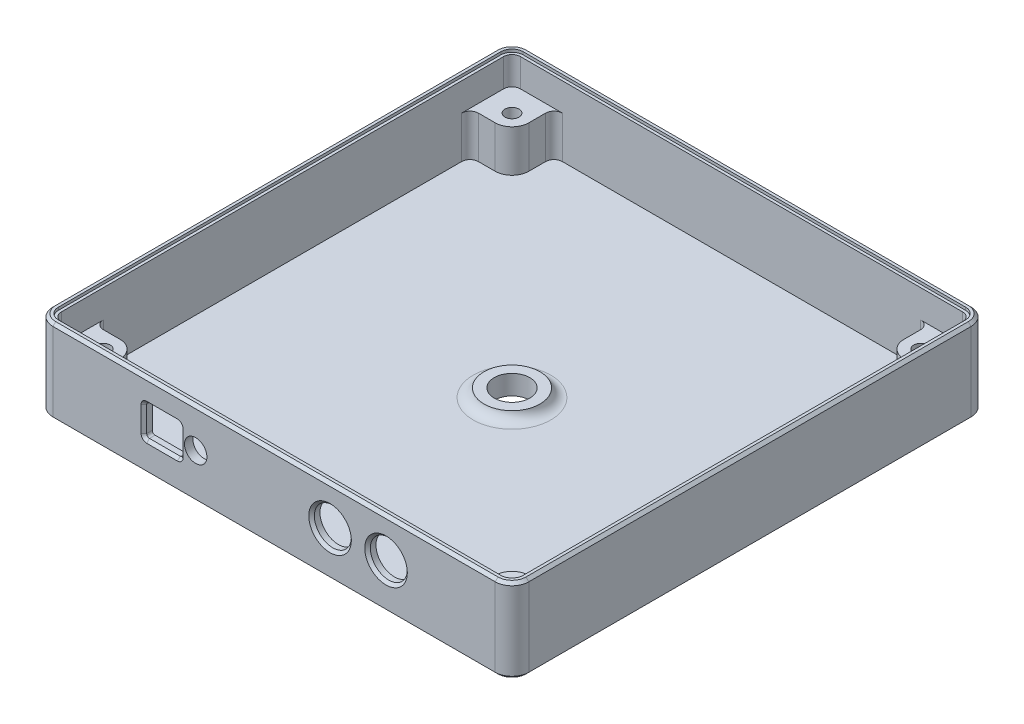
from build123d import *

# Parameters (mm, degrees)
SKETCH1_W                   = 85
SKETCH1_H                   = 85
BOSS_EXTRUDE1_DEPTH         = 15
FILLET1_R                   = 3
CHAMFER1_SIZE               = 0.5
CHAMFER2_SIZE               = 0.5
CUT_EXTRUDE1_DEPTH          = 11.5
F_1_4_0_25_DIAMETER_HOLE1_D = 6.35
BOSS_EXTRUDE2_START         = 6
BOSS_EXTRUDE2_DEPTH         = 6
FILLET2_R                   = 1.5
CUT_EXTRUDE2_START          = -1.5
SKETCH7_R                   = 5
CUT_EXTRUDE2_DEPTH          = 1.5
FILLET4_R                   = 2
SKETCH11_R                  = 2
SKETCH11_R_2                = 2.8
CUT_EXTRUDE4_DEPTH          = 10
CHAMFER4_SIZE               = 0.5
CUT_EXTRUDE5_DEPTH          = 0.5
SKETCH13_R                  = 1.25
CUT_EXTRUDE6_DEPTH          = 7


with BuildPart() as part:
    # Sketch1 → Boss-Extrude1 (new body)
    with BuildSketch(Plane(origin=(0, 0, 0), x_dir=(1, 0, 0), z_dir=(0, 1, 0))):
        with Locations((42.5, 42.5)):
            Rectangle(SKETCH1_W, SKETCH1_H)
    extrude(amount=BOSS_EXTRUDE1_DEPTH)

    # Fillet1
    fillet1_edges = [part.edges().sort_by_distance(p)[0] for p in [
        (0, 7.5, -85),
        (85, 7.5, -85),
        (85, 7.5, 0),
        (0, 7.5, 0),
    ]]
    fillet(fillet1_edges, radius=FILLET1_R)

    # Chamfer1
    chamfer1_edges = [part.edges().sort_by_distance(p)[0] for p in [
        (0, 0, -42.5),
        (42.5, 0, -85),
        (85, 0, -42.5),
        (42.5, 0, 0),
        (0.878679656, 0, -0.878679656),
        (84.121320344, 0, -0.878679656),
        (84.121320344, 0, -84.121320344),
        (0.878679656, 0, -84.121320344),
    ]]
    chamfer(chamfer1_edges, length=CHAMFER1_SIZE)

    # Chamfer2
    chamfer2_edges = [part.edges().sort_by_distance(p)[0] for p in [
        (0, 15, -42.5),
        (42.5, 15, -85),
        (42.5, 15, 0),
        (85, 15, -42.5),
        (0.878679656, 15, -0.878679656),
        (84.121320344, 15, -0.878679656),
        (84.121320344, 15, -84.121320344),
        (0.878679656, 15, -84.121320344),
    ]]
    chamfer(chamfer2_edges, length=CHAMFER2_SIZE)

    # Sketch2 → Cut-Extrude1 (cut)
    with BuildSketch(Plane(origin=(0, 15, 0), x_dir=(1, 0, 0), z_dir=(0, 1, 0))):
        with BuildLine():
            Line((83.5, 3), (83.5, 82))
            ThreePointArc((83.5, 82), (83.060660172, 83.060660172), (82, 83.5))
            Line((82, 83.5), (3, 83.5))
            ThreePointArc((3, 83.5), (1.939339828, 83.060660172), (1.5, 82))
            Line((1.5, 82), (1.5, 3))
            ThreePointArc((1.5, 3), (1.939339828, 1.939339828), (3, 1.5))
            Line((3, 1.5), (82, 1.5))
            ThreePointArc((82, 1.5), (83.060660172, 1.939339828), (83.5, 3))
        make_face()
    extrude(amount=-CUT_EXTRUDE1_DEPTH, mode=Mode.SUBTRACT)

    # 1/4 (0.25) Diameter Hole1 (through all)
    with Locations(Plane(origin=(42.5, 0, -42.5), x_dir=(0, 0, -1), z_dir=(0, -1, 0))):
        with Locations((0, 0)):
            Hole(F_1_4_0_25_DIAMETER_HOLE1_D / 2)

    # Sketch6 → Boss-Extrude2 (add)
    with BuildSketch(Plane(origin=(0, 3.5, 0), x_dir=(1, 0, 0), z_dir=(0, 1, 0)).offset(BOSS_EXTRUDE2_START)):
        with BuildLine():
            Line((1.5, 76), (6, 76))
            ThreePointArc((6, 76), (8.121320344, 76.878679656), (9, 79))
            Line((9, 79), (9, 83.5))
            Line((9, 83.5), (3, 83.5))
            ThreePointArc((3, 83.5), (1.939339828, 83.060660172), (1.5, 82))
            Line((1.5, 82), (1.5, 76))
        make_face()
        with BuildLine():
            Line((82, 83.5), (76, 83.5))
            Line((76, 83.5), (76, 79))
            ThreePointArc((76, 79), (76.878679656, 76.878679656), (79, 76))
            Line((79, 76), (83.5, 76))
            Line((83.5, 76), (83.5, 82))
            ThreePointArc((83.5, 82), (83.060660172, 83.060660172), (82, 83.5))
        make_face()
        with BuildLine():
            Line((6, 9), (1.5, 9))
            Line((1.5, 9), (1.5, 3))
            ThreePointArc((1.5, 3), (1.939339828, 1.939339828), (3, 1.5))
            Line((3, 1.5), (9, 1.5))
            Line((9, 1.5), (9, 6))
            ThreePointArc((9, 6), (8.121320344, 8.121320344), (6, 9))
        make_face()
        with BuildLine():
            Line((83.5, 3), (83.5, 9))
            Line((83.5, 9), (79, 9))
            ThreePointArc((79, 9), (76.878679656, 8.121320344), (76, 6))
            Line((76, 6), (76, 1.5))
            Line((76, 1.5), (82, 1.5))
            ThreePointArc((82, 1.5), (83.060660172, 1.939339828), (83.5, 3))
        make_face()
    extrude(amount=-BOSS_EXTRUDE2_DEPTH)

    # Fillet2
    fillet2_edges = [part.edges().sort_by_distance(p)[0] for p in [
        (9, 6.5, -1.5),
        (1.5, 6.5, -9),
        (1.5, 6.5, -76),
        (9, 6.5, -83.5),
        (83.5, 6.5, -9),
        (76, 6.5, -1.5),
        (83.5, 6.5, -76),
        (76, 6.5, -83.5),
    ]]
    fillet(fillet2_edges, radius=FILLET2_R)

    # Sketch7 → Cut-Extrude2 (cut)
    with BuildSketch(Plane(origin=(0, 3.5, 0), x_dir=(1, 0, 0), z_dir=(0, 1, 0)).offset(CUT_EXTRUDE2_START)):
        with BuildLine():
            Line((74.5, 83.5), (10.5, 83.5))
            ThreePointArc((10.5, 83.5), (9.439339828, 83.060660172), (9, 82))
            Line((9, 82), (9, 79))
            ThreePointArc((9, 79), (8.121320344, 76.878679656), (6, 76))
            Line((6, 76), (3, 76))
            ThreePointArc((3, 76), (1.939339828, 75.560660172), (1.5, 74.5))
            Line((1.5, 74.5), (1.5, 10.5))
            ThreePointArc((1.5, 10.5), (1.939339828, 9.439339828), (3, 9))
            Line((3, 9), (6, 9))
            ThreePointArc((6, 9), (8.121320344, 8.121320344), (9, 6))
            Line((9, 6), (9, 3))
            ThreePointArc((9, 3), (9.439339828, 1.939339828), (10.5, 1.5))
            Line((10.5, 1.5), (74.5, 1.5))
            ThreePointArc((74.5, 1.5), (75.560660172, 1.939339828), (76, 3))
            Line((76, 3), (76, 6))
            ThreePointArc((76, 6), (76.878679656, 8.121320344), (79, 9))
            Line((79, 9), (82, 9))
            ThreePointArc((82, 9), (83.060660172, 9.439339828), (83.5, 10.5))
            Line((83.5, 10.5), (83.5, 74.5))
            ThreePointArc((83.5, 74.5), (83.060660172, 75.560660172), (82, 76))
            Line((82, 76), (79, 76))
            ThreePointArc((79, 76), (76.878679656, 76.878679656), (76, 79))
            Line((76, 79), (76, 82))
            ThreePointArc((76, 82), (75.560660172, 83.060660172), (74.5, 83.5))
        make_face()
        with Locations(Location((42.5, 42.5, 0), (0, 0, 270))):
            Circle(SKETCH7_R, mode=Mode.SUBTRACT)
    extrude(amount=CUT_EXTRUDE2_DEPTH, mode=Mode.SUBTRACT)

    # Fillet4
    # the kernel refuses this fillet: 2 mm, written as the material it adds along each edge
    with BuildSketch(Plane(origin=(42.5, 2, -42.5), x_dir=(0, 0, 1), z_dir=(-1, 0, 0))) as fillet4_piece_1:
        with BuildLine():
            CenterArc((6.936491673, 2), FILLET4_R, 194.477512186, 75.522487814)
            Line((5, 1.5), (4.961270167, 1.49))
            ThreePointArc((4.961270167, 1.49), (4.96, 0.75), (4.96, 0))
            Line((4.96, 0), (5, -0.04))
            Line((5, -0.04), (6.936491673, -0.04))
            Line((6.936491673, -0.04), (6.936491673, 0))
        make_face()
    revolve(axis=Axis((42.5, 2, -42.5), (0, 1, 0)))

    # Sketch11 → Cut-Extrude4 (cut)
    # profile 1 of 7: a face of its own
    with BuildSketch(Plane.XY):
        with BuildLine():
            Line((25.249968416, 10.803831368), (19.749968416, 10.803830887))
            ThreePointArc((19.749968416, 10.803830887), (19.396415038, 10.657384247), (19.249968459, 10.303830844))
            Line((19.249968459, 10.303830844), (19.249968853, 5.803830844))
            ThreePointArc((19.249968853, 5.803830844), (19.396415493, 5.450277466), (19.749968897, 5.303830887))
            Line((19.749968897, 5.303830887), (25.249968897, 5.303831368))
            ThreePointArc((25.249968897, 5.303831368), (25.603522274, 5.450278008), (25.749968853, 5.803831412))
            Line((25.749968853, 5.803831412), (25.749968459, 10.303831412))
            ThreePointArc((25.749968459, 10.303831412), (25.603521819, 10.65738479), (25.249968416, 10.803831368))
        make_face()
        Polygon((19.499968875, 5.553830865), (25.499968875, 5.55383139), (25.499968438, 10.55383139), (19.499968438, 10.553830865), align=None, mode=Mode.SUBTRACT)
    # profile 2 of 7: a face of its own
    with BuildSketch(Plane.XY):
        Polygon((19.499968438, 10.553830865), (19.499968875, 5.553830865), (25.499968875, 5.55383139), (25.499968438, 10.55383139), align=None)
    # profile 3 of 7: a face of its own
    with BuildSketch(Plane.XY):
        with Locations((28.500079772, 8.056829796)):
            Circle(SKETCH11_R)
    # profile 4 of 7: a face of its own
    with BuildSketch(Plane.XY):
        with BuildLine():
            add(Edge.make_bspline(
                [(55.802013111, 8.053836253), (55.802013098, 8.196396308), (55.784958055, 8.481516418), (55.653659792, 9.13474007), (55.242467051, 10.047300893), (54.146311084, 11.061585692), (52.50201281, 11.499961172), (50.857714612, 11.061585405), (49.761558823, 10.047300414), (49.350366241, 9.134739519), (49.219068092, 8.481515844), (49.193485601, 8.053835675), (49.219068167, 7.62615551), (49.35036643, 6.972931858), (49.761559171, 6.060371035), (50.857715138, 5.046086236), (52.502013412, 4.607710756), (54.14631161, 5.046086523), (55.242467399, 6.060371514), (55.653659981, 6.972932409), (55.784958129, 7.626156084), (55.802013123, 7.911276197), (55.802013111, 8.053836253)],
                knots=[0, 0, 0, 0, 0.03125, 0.0625, 0.125, 0.1875, 0.25, 0.3125, 0.375, 0.4375, 0.46875, 0.5, 0.53125, 0.5625, 0.625, 0.6875, 0.75, 0.8125, 0.875, 0.9375, 0.96875, 1, 1, 1, 1], degree=3))
        make_face()
        with Locations((52.502013111, 8.053835964)):
            Circle(SKETCH11_R_2, mode=Mode.SUBTRACT)
    # profile 5 of 7: a face of its own
    with BuildSketch(Plane.XY):
        with Locations((52.502013111, 8.053835964)):
            Circle(SKETCH11_R_2)
    # profile 6 of 7: a face of its own
    with BuildSketch(Plane.XY):
        with BuildLine():
            add(Edge.make_bspline(
                [(65.802013111, 8.053836253), (65.802013098, 8.196396308), (65.784958055, 8.481516418), (65.653659792, 9.13474007), (65.242467051, 10.047300893), (64.146311084, 11.061585692), (62.50201281, 11.499961172), (60.857714612, 11.061585405), (59.761558823, 10.047300414), (59.350366241, 9.134739519), (59.219068092, 8.481515844), (59.193485601, 8.053835675), (59.219068167, 7.62615551), (59.35036643, 6.972931858), (59.761559171, 6.060371035), (60.857715138, 5.046086236), (62.502013412, 4.607710756), (64.14631161, 5.046086523), (65.242467399, 6.060371514), (65.653659981, 6.972932409), (65.784958129, 7.626156084), (65.802013123, 7.911276197), (65.802013111, 8.053836253)],
                knots=[0, 0, 0, 0, 0.03125, 0.0625, 0.125, 0.1875, 0.25, 0.3125, 0.375, 0.4375, 0.46875, 0.5, 0.53125, 0.5625, 0.625, 0.6875, 0.75, 0.8125, 0.875, 0.9375, 0.96875, 1, 1, 1, 1], degree=3))
        make_face()
        with Locations((62.502013111, 8.053835964)):
            Circle(SKETCH11_R_2, mode=Mode.SUBTRACT)
    # profile 7 of 7: a face of its own
    with BuildSketch(Plane.XY):
        with Locations((62.502013111, 8.053835964)):
            Circle(SKETCH11_R_2)
    extrude(amount=-CUT_EXTRUDE4_DEPTH, mode=Mode.SUBTRACT)

    # Chamfer4
    chamfer4_edges = [part.edges().sort_by_distance(p)[0] for p in [
        (22.499968416, 10.803831128, 0),
        (19.396415038, 10.657384247, 0),
        (19.249968656, 8.053830844, 0),
        (19.396415493, 5.450277466, 0),
        (22.499968897, 5.303831128, 0),
        (25.603522274, 5.450278008, 0),
        (25.749968656, 8.053831412, 0),
        (25.603521819, 10.65738479, 0),
        (49.202013111, 8.053835676, 0),
        (59.202013111, 8.053835676, 0),
    ]]
    chamfer(chamfer4_edges, length=CHAMFER4_SIZE)

    # Sketch12 → Cut-Extrude5 (cut)
    with BuildSketch(Plane(origin=(0, 15, 0), x_dir=(1, 0, 0), z_dir=(0, 1, 0))):
        with BuildLine():
            Line((3, 1), (82, 1))
            ThreePointArc((82, 1), (83.414213562, 1.585786438), (84, 3))
            Line((84, 3), (84, 82))
            ThreePointArc((84, 82), (83.414213562, 83.414213562), (82, 84))
            Line((82, 84), (3, 84))
            ThreePointArc((3, 84), (1.585786438, 83.414213562), (1, 82))
            Line((1, 82), (1, 3))
            ThreePointArc((1, 3), (1.585786438, 1.585786438), (3, 1))
        make_face()
        with BuildLine():
            Line((82, 83.5), (3, 83.5))
            ThreePointArc((3, 83.5), (1.939339828, 83.060660172), (1.5, 82))
            Line((1.5, 82), (1.5, 3))
            ThreePointArc((1.5, 3), (1.939339828, 1.939339828), (3, 1.5))
            Line((3, 1.5), (82, 1.5))
            ThreePointArc((82, 1.5), (83.060660172, 1.939339828), (83.5, 3))
            Line((83.5, 3), (83.5, 82))
            ThreePointArc((83.5, 82), (83.060660172, 83.060660172), (82, 83.5))
        make_face(mode=Mode.SUBTRACT)
    extrude(amount=-CUT_EXTRUDE5_DEPTH, mode=Mode.SUBTRACT)

    # Sketch13 → Cut-Extrude6 (cut)
    with BuildSketch(Plane(origin=(0, 9.5, 0), x_dir=(1, 0, 0), z_dir=(0, 1, 0))):
        with Locations(Location((6.00000122, 78.99999878, 0), (0, 0, 270))):
            Circle(SKETCH13_R)
        with Locations(Location((79, 78.99999878, 0), (0, 0, 270))):
            Circle(SKETCH13_R)
        with Locations(Location((79, 6, 0), (0, 0, 270))):
            Circle(SKETCH13_R)
        with Locations(Location((6.00000122, 6, 0), (0, 0, 270))):
            Circle(SKETCH13_R)
    extrude(amount=-CUT_EXTRUDE6_DEPTH, mode=Mode.SUBTRACT)


solid = part.part
